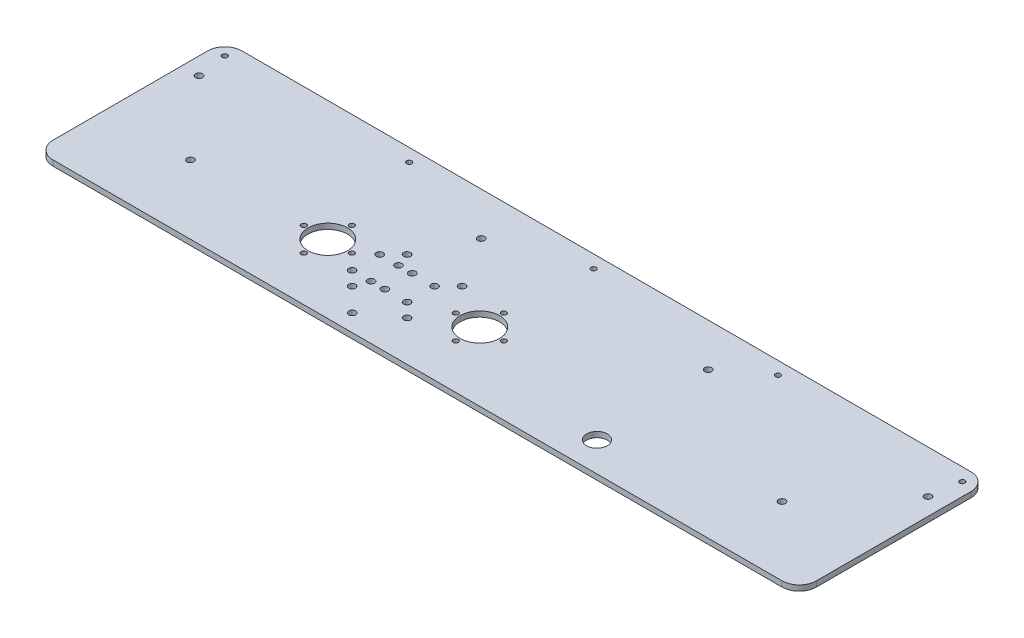
from build123d import *

# Parameters (mm, degrees)
SKETCH1_R           = 2
SKETCH1_R_2         = 1.5
SKETCH1_R_3         = 6
SKETCH1_R_4         = 11.5
BOSS_EXTRUDE1_DEPTH = 3.175
FILLET1_R           = 10
SKETCH2_R           = 2
CUT_EXTRUDE1_DEPTH  = 10
SKETCH3_R           = 2
CUT_EXTRUDE2_DEPTH  = 10


with BuildPart() as part:
    # Sketch1 → Boss-Extrude1 (new body)
    with BuildSketch(Plane(origin=(0, 0, 0), x_dir=(1, 0, 0), z_dir=(0, 1, 0))):
        Polygon((-26.799577535, 0), (417.700422465, 0), (417.700422465, 17.22815868), (417.700422465, 110), (-26.799577535, 110), align=None)
        with Locations((23.200422465, 40)):
            Circle(SKETCH1_R, mode=Mode.SUBTRACT)
        with Locations((89.200422465, 40)):
            Circle(SKETCH1_R_2, mode=Mode.SUBTRACT)
        with Locations((103.200422465, 26)):
            Circle(SKETCH1_R_2, mode=Mode.SUBTRACT)
        with Locations((117.200422465, 40)):
            Circle(SKETCH1_R_2, mode=Mode.SUBTRACT)
        with Locations((177.700422465, 40)):
            Circle(SKETCH1_R_2, mode=Mode.SUBTRACT)
        with Locations((191.700422465, 26)):
            Circle(SKETCH1_R_2, mode=Mode.SUBTRACT)
        with Locations((205.700422465, 40)):
            Circle(SKETCH1_R_2, mode=Mode.SUBTRACT)
        with Locations((367.700422465, 40)):
            Circle(SKETCH1_R, mode=Mode.SUBTRACT)
        with Locations((147.450422465, 10)):
            Circle(SKETCH1_R, mode=Mode.SUBTRACT)
        with Locations((282.700422465, 17.22815868)):
            Circle(SKETCH1_R_3, mode=Mode.SUBTRACT)
        with Locations((-16.799577535, 85)):
            Circle(SKETCH1_R, mode=Mode.SUBTRACT)
        with Locations((147.450422465, 85)):
            Circle(SKETCH1_R, mode=Mode.SUBTRACT)
        with Locations((103.200422465, 54)):
            Circle(SKETCH1_R_2, mode=Mode.SUBTRACT)
        with Locations((103.200422465, 40)):
            Circle(SKETCH1_R_4, mode=Mode.SUBTRACT)
        with Locations((279.700422465, 85)):
            Circle(SKETCH1_R, mode=Mode.SUBTRACT)
        with Locations((191.700422465, 54)):
            Circle(SKETCH1_R_2, mode=Mode.SUBTRACT)
        with Locations((191.700422465, 40)):
            Circle(SKETCH1_R_4, mode=Mode.SUBTRACT)
        with Locations((407.700422465, 85)):
            Circle(SKETCH1_R, mode=Mode.SUBTRACT)
        with Locations((-19.299577535, 102.5)):
            Circle(SKETCH1_R_2, mode=Mode.SUBTRACT)
        with Locations((88.075422465, 102.5)):
            Circle(SKETCH1_R_2, mode=Mode.SUBTRACT)
        with Locations((195.450422465, 102.5)):
            Circle(SKETCH1_R_2, mode=Mode.SUBTRACT)
        with Locations((302.825422465, 102.5)):
            Circle(SKETCH1_R_2, mode=Mode.SUBTRACT)
        with Locations((410.200422465, 102.5)):
            Circle(SKETCH1_R_2, mode=Mode.SUBTRACT)
    extrude(amount=BOSS_EXTRUDE1_DEPTH)

    # Fillet1
    fillet1_edges = [part.edges().sort_by_distance(p)[0] for p in [
        (417.700422465, 1.5875, -110),
        (417.700422465, 1.5875, 0),
        (-26.799577535, 1.5875, 0),
        (-26.799577535, 1.5875, -110),
    ]]
    fillet(fillet1_edges, radius=FILLET1_R)

    # Sketch2 → Cut-Extrude1 (cut)
    with BuildSketch(Plane(origin=(0, 3.175, 0), x_dir=(1, 0, 0), z_dir=(0, 1, 0))):
        with Locations((133.950422465, 55.40559892)):
            Circle(SKETCH2_R)
        with Locations((165.950422465, 55.40559892)):
            Circle(SKETCH2_R)
        with Locations((133.950422465, 23.40559892)):
            Circle(SKETCH2_R)
        with Locations((165.950422465, 23.40559892)):
            Circle(SKETCH2_R)
        with Locations((157.950422465, 31.40559892)):
            Circle(SKETCH2_R)
        with Locations((125.950422465, 31.40559892)):
            Circle(SKETCH2_R)
        with Locations((125.950422465, 47.40559892)):
            Circle(SKETCH2_R)
        with Locations((157.950422465, 47.40559892)):
            Circle(SKETCH2_R)
    extrude(amount=-CUT_EXTRUDE1_DEPTH, mode=Mode.SUBTRACT)

    # Sketch3 → Cut-Extrude2 (cut)
    with BuildSketch(Plane.XZ):
        with Locations((136.950422465, -47.40559892)):
            Circle(SKETCH3_R)
        with Locations((144.950422465, -31.40559892)):
            Circle(SKETCH3_R)
        with Locations((136.950422465, -31.40559892)):
            Circle(SKETCH3_R)
        with Locations((144.950422465, -47.40559892)):
            Circle(SKETCH3_R)
    extrude(amount=-CUT_EXTRUDE2_DEPTH, mode=Mode.SUBTRACT)


solid = part.part
